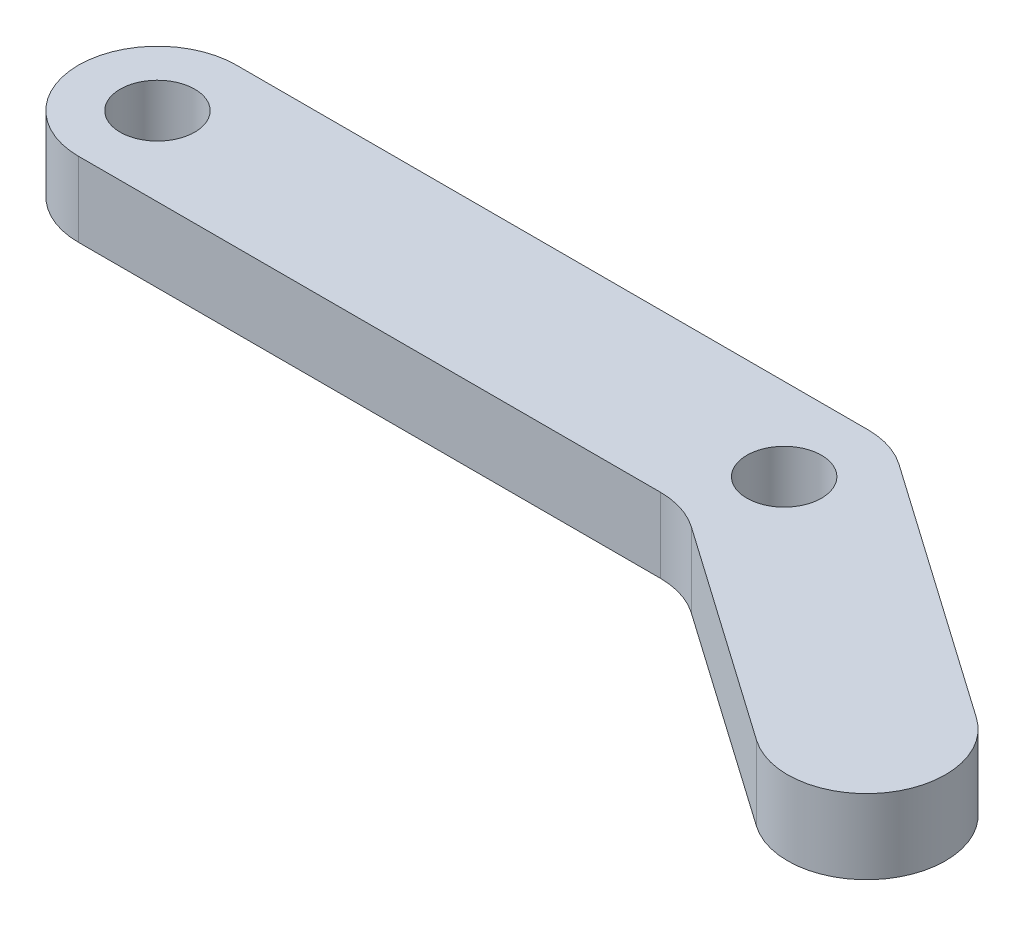
from build123d import *

# Parameters (mm, degrees)
SKETCH1_R           = 1.5
BOSS_EXTRUDE1_DEPTH = 3


with BuildPart() as part:
    # Sketch1 → Boss-Extrude1 (new body)
    with BuildSketch(Plane(origin=(0, 0, 0), x_dir=(1, 0, 0), z_dir=(0, 1, 0))):
        with BuildLine():
            Line((0, -3.175), (23.397852691, -3.175))
            ThreePointArc((23.397852691, -3.175), (24.352593604, -3.321948681), (25.218957876, -3.749192259))
            Line((25.218957876, -3.749192259), (33.982125777, -9.885228482))
            ThreePointArc((33.982125777, -9.885228482), (38.404038703, -9.105525927), (37.624336148, -4.683613001))
            Line((37.624336148, -4.683613001), (27.221105185, 2.600807741))
            ThreePointArc((27.221105185, 2.600807741), (26.354740913, 3.028051319), (25.4, 3.175))
            Line((25.4, 3.175), (0, 3.175))
            ThreePointArc((0, 3.175), (-3.175, 0), (0, -3.175))
        make_face()
        with Locations((25.353667259, -0.146948681)):
            Circle(SKETCH1_R, mode=Mode.SUBTRACT)
        Circle(SKETCH1_R, mode=Mode.SUBTRACT)
    extrude(amount=BOSS_EXTRUDE1_DEPTH)


solid = part.part
